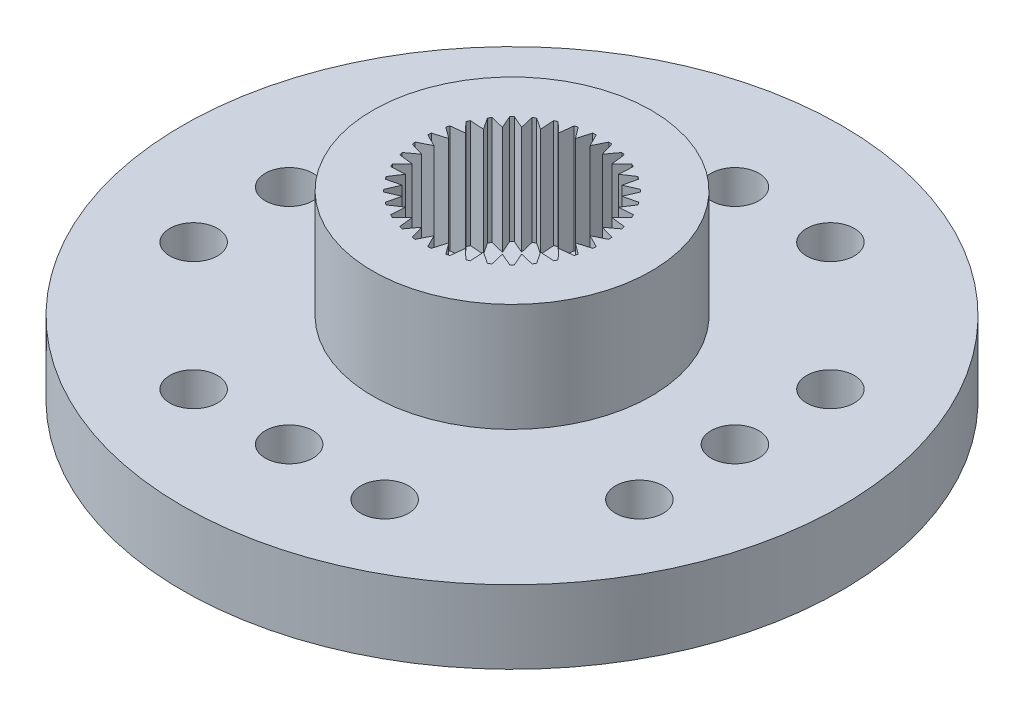
from build123d import *

# Parameters (mm, degrees)
SKETCH1_R                  = 4.375
BOSS_EXTRUDE1_DEPTH        = 3.4
CUT_EXTRUDE1_START         = -2.35
CUT_EXTRUDE1_OUTLINE_R     = 10.35
CUT_EXTRUDE1_OUTLINE_R_2   = 0.75
CUT_EXTRUDE1_OUTLINE_R_3   = 1.5
CUT_EXTRUDE1_DEPTH         = 2.05
CUT_EXTRUDE1_START_2       = -0.3
CUT_EXTRUDE1_2_OUTLINE_R   = 10.35
CUT_EXTRUDE1_2_OUTLINE_R_2 = 0.75
CUT_EXTRUDE1_2_OUTLINE_R_3 = 4.4
CUT_EXTRUDE1_2_OUTLINE_R_4 = 3.25
CUT_EXTRUDE1_2_OUTLINE_R_5 = 2.75
CUT_EXTRUDE1_2_DEPTH       = 0.25


# Read off the part's stored shape, not the designer's step: Cut-Extrude1
with BuildPart() as part:
    # Sketch1 → Boss-Extrude1 (new body)
    with BuildSketch(Plane(origin=(0, 5.75, 0), x_dir=(1, 0, 0), z_dir=(0, 1, 0))):
        with Locations(Location((0, 0, 0), (0, 0, 90))):
            Circle(SKETCH1_R)
        with BuildLine():
            Line((0, -2.45), (-0.196605286, -2.843210573))
            ThreePointArc((-0.196605286, -2.843210573), (-0.248393867, -2.83915489), (-0.300099924, -2.834155965))
            Line((-0.300099924, -2.834155965), (-0.425438035, -2.412778995))
            Line((-0.425438035, -2.412778995), (-0.687336745, -2.765875666))
            ThreePointArc((-0.687336745, -2.765875666), (-0.737634279, -2.752888605), (-0.787686751, -2.738986963))
            Line((-0.787686751, -2.738986963), (-0.837949351, -2.302246921))
            Line((-0.837949351, -2.302246921), (-1.157183824, -2.604501026))
            ThreePointArc((-1.157183824, -2.604501026), (-1.204462046, -2.582977193), (-1.251340114, -2.560595228))
            Line((-1.251340114, -2.560595228), (-1.225, -2.121762239))
            Line((-1.225, -2.121762239), (-1.591870459, -2.363989941))
            ThreePointArc((-1.591870459, -2.363989941), (-1.634692844, -2.334583326), (-1.676972141, -2.304401102))
            Line((-1.676972141, -2.304401102), (-1.574829644, -1.876808886))
            Line((-1.574829644, -1.876808886), (-1.978188915, -2.051650218))
            ThreePointArc((-1.978188915, -2.051650218), (-2.015254326, -2.015254326), (-2.051650218, -1.978188915))
            Line((-2.051650218, -1.978188915), (-1.876808886, -1.574829644))
            Line((-1.876808886, -1.574829644), (-2.304401102, -1.676972141))
            ThreePointArc((-2.304401102, -1.676972141), (-2.334583326, -1.634692844), (-2.363989941, -1.591870459))
            Line((-2.363989941, -1.591870459), (-2.121762239, -1.225))
            Line((-2.121762239, -1.225), (-2.560595228, -1.251340114))
            ThreePointArc((-2.560595228, -1.251340114), (-2.582977193, -1.204462046), (-2.604501026, -1.157183824))
            Line((-2.604501026, -1.157183824), (-2.302246921, -0.837949351))
            Line((-2.302246921, -0.837949351), (-2.738986963, -0.787686751))
            ThreePointArc((-2.738986963, -0.787686751), (-2.752888605, -0.737634279), (-2.765875666, -0.687336745))
            Line((-2.765875666, -0.687336745), (-2.412778995, -0.425438035))
            Line((-2.412778995, -0.425438035), (-2.834155965, -0.300099924))
            ThreePointArc((-2.834155965, -0.300099924), (-2.83915489, -0.248393867), (-2.843210573, -0.196605286))
            Line((-2.843210573, -0.196605286), (-2.45, 0))
            Line((-2.45, 0), (-2.843210573, 0.196605286))
            ThreePointArc((-2.843210573, 0.196605286), (-2.83915489, 0.248393867), (-2.834155965, 0.300099924))
            Line((-2.834155965, 0.300099924), (-2.412778995, 0.425438035))
            Line((-2.412778995, 0.425438035), (-2.765875666, 0.687336745))
            ThreePointArc((-2.765875666, 0.687336745), (-2.752888605, 0.737634279), (-2.738986963, 0.787686751))
            Line((-2.738986963, 0.787686751), (-2.302246921, 0.837949351))
            Line((-2.302246921, 0.837949351), (-2.604501026, 1.157183824))
            ThreePointArc((-2.604501026, 1.157183824), (-2.582977193, 1.204462046), (-2.560595228, 1.251340114))
            Line((-2.560595228, 1.251340114), (-2.121762239, 1.225))
            Line((-2.121762239, 1.225), (-2.363989941, 1.591870459))
            ThreePointArc((-2.363989941, 1.591870459), (-2.334583326, 1.634692844), (-2.304401102, 1.676972141))
            Line((-2.304401102, 1.676972141), (-1.876808886, 1.574829644))
            Line((-1.876808886, 1.574829644), (-2.051650218, 1.978188915))
            ThreePointArc((-2.051650218, 1.978188915), (-2.015254326, 2.015254326), (-1.978188915, 2.051650218))
            Line((-1.978188915, 2.051650218), (-1.574829644, 1.876808886))
            Line((-1.574829644, 1.876808886), (-1.676972141, 2.304401102))
            ThreePointArc((-1.676972141, 2.304401102), (-1.634692844, 2.334583326), (-1.591870459, 2.363989941))
            Line((-1.591870459, 2.363989941), (-1.225, 2.121762239))
            Line((-1.225, 2.121762239), (-1.251340114, 2.560595228))
            ThreePointArc((-1.251340114, 2.560595228), (-1.204462046, 2.582977193), (-1.157183824, 2.604501026))
            Line((-1.157183824, 2.604501026), (-0.837949351, 2.302246921))
            Line((-0.837949351, 2.302246921), (-0.787686751, 2.738986963))
            ThreePointArc((-0.787686751, 2.738986963), (-0.737634279, 2.752888605), (-0.687336745, 2.765875666))
            Line((-0.687336745, 2.765875666), (-0.425438035, 2.412778995))
            Line((-0.425438035, 2.412778995), (-0.300099924, 2.834155965))
            ThreePointArc((-0.300099924, 2.834155965), (-0.248393867, 2.83915489), (-0.196605286, 2.843210573))
            Line((-0.196605286, 2.843210573), (0, 2.45))
            Line((0, 2.45), (0.196605286, 2.843210573))
            ThreePointArc((0.196605286, 2.843210573), (0.248393867, 2.83915489), (0.300099924, 2.834155965))
            Line((0.300099924, 2.834155965), (0.425438035, 2.412778995))
            Line((0.425438035, 2.412778995), (0.687336745, 2.765875666))
            ThreePointArc((0.687336745, 2.765875666), (0.737634279, 2.752888605), (0.787686751, 2.738986963))
            Line((0.787686751, 2.738986963), (0.837949351, 2.302246921))
            Line((0.837949351, 2.302246921), (1.157183824, 2.604501026))
            ThreePointArc((1.157183824, 2.604501026), (1.204462046, 2.582977193), (1.251340114, 2.560595228))
            Line((1.251340114, 2.560595228), (1.225, 2.121762239))
            Line((1.225, 2.121762239), (1.591870459, 2.363989941))
            ThreePointArc((1.591870459, 2.363989941), (1.634692844, 2.334583326), (1.676972141, 2.304401102))
            Line((1.676972141, 2.304401102), (1.574829644, 1.876808886))
            Line((1.574829644, 1.876808886), (1.978188915, 2.051650218))
            ThreePointArc((1.978188915, 2.051650218), (2.015254326, 2.015254326), (2.051650218, 1.978188915))
            Line((2.051650218, 1.978188915), (1.876808886, 1.574829644))
            Line((1.876808886, 1.574829644), (2.304401102, 1.676972141))
            ThreePointArc((2.304401102, 1.676972141), (2.334583326, 1.634692844), (2.363989941, 1.591870459))
            Line((2.363989941, 1.591870459), (2.121762239, 1.225))
            Line((2.121762239, 1.225), (2.560595228, 1.251340114))
            ThreePointArc((2.560595228, 1.251340114), (2.582977193, 1.204462046), (2.604501026, 1.157183824))
            Line((2.604501026, 1.157183824), (2.302246921, 0.837949351))
            Line((2.302246921, 0.837949351), (2.738986963, 0.787686751))
            ThreePointArc((2.738986963, 0.787686751), (2.752888605, 0.737634279), (2.765875666, 0.687336745))
            Line((2.765875666, 0.687336745), (2.412778995, 0.425438035))
            Line((2.412778995, 0.425438035), (2.834155965, 0.300099924))
            ThreePointArc((2.834155965, 0.300099924), (2.83915489, 0.248393867), (2.843210573, 0.196605286))
            Line((2.843210573, 0.196605286), (2.45, 0))
            Line((2.45, 0), (2.843210573, -0.196605286))
            ThreePointArc((2.843210573, -0.196605286), (2.83915489, -0.248393867), (2.834155965, -0.300099924))
            Line((2.834155965, -0.300099924), (2.412778995, -0.425438035))
            Line((2.412778995, -0.425438035), (2.765875666, -0.687336745))
            ThreePointArc((2.765875666, -0.687336745), (2.752888605, -0.737634279), (2.738986963, -0.787686751))
            Line((2.738986963, -0.787686751), (2.302246921, -0.837949351))
            Line((2.302246921, -0.837949351), (2.604501026, -1.157183824))
            ThreePointArc((2.604501026, -1.157183824), (2.582977193, -1.204462046), (2.560595228, -1.251340114))
            Line((2.560595228, -1.251340114), (2.121762239, -1.225))
            Line((2.121762239, -1.225), (2.363989941, -1.591870459))
            ThreePointArc((2.363989941, -1.591870459), (2.334583326, -1.634692844), (2.304401102, -1.676972141))
            Line((2.304401102, -1.676972141), (1.876808886, -1.574829644))
            Line((1.876808886, -1.574829644), (2.051650218, -1.978188915))
            ThreePointArc((2.051650218, -1.978188915), (2.015254326, -2.015254326), (1.978188915, -2.051650218))
            Line((1.978188915, -2.051650218), (1.574829644, -1.876808886))
            Line((1.574829644, -1.876808886), (1.676972141, -2.304401102))
            ThreePointArc((1.676972141, -2.304401102), (1.634692844, -2.334583326), (1.591870459, -2.363989941))
            Line((1.591870459, -2.363989941), (1.225, -2.121762239))
            Line((1.225, -2.121762239), (1.251340114, -2.560595228))
            ThreePointArc((1.251340114, -2.560595228), (1.204462046, -2.582977193), (1.157183824, -2.604501026))
            Line((1.157183824, -2.604501026), (0.837949351, -2.302246921))
            Line((0.837949351, -2.302246921), (0.787686751, -2.738986963))
            ThreePointArc((0.787686751, -2.738986963), (0.737634279, -2.752888605), (0.687336745, -2.765875666))
            Line((0.687336745, -2.765875666), (0.425438035, -2.412778995))
            Line((0.425438035, -2.412778995), (0.300099924, -2.834155965))
            ThreePointArc((0.300099924, -2.834155965), (0.248393867, -2.83915489), (0.196605286, -2.843210573))
            Line((0.196605286, -2.843210573), (0, -2.45))
        make_face(mode=Mode.SUBTRACT)
    extrude(amount=-BOSS_EXTRUDE1_DEPTH)


with BuildPart() as body_2:
    # Cut-Extrude1 outline → Cut-Extrude1 (new body)
    with BuildSketch(Plane.XZ.offset(CUT_EXTRUDE1_START)):
        Circle(CUT_EXTRUDE1_OUTLINE_R)
        with Locations((-3, -7)):
            Circle(CUT_EXTRUDE1_OUTLINE_R_2, mode=Mode.SUBTRACT)
        with Locations((-7, -3)):
            Circle(CUT_EXTRUDE1_OUTLINE_R_2, mode=Mode.SUBTRACT)
        with Locations((0, -7)):
            Circle(CUT_EXTRUDE1_OUTLINE_R_2, mode=Mode.SUBTRACT)
        with Locations((3, -7)):
            Circle(CUT_EXTRUDE1_OUTLINE_R_2, mode=Mode.SUBTRACT)
        with Locations((7, -3)):
            Circle(CUT_EXTRUDE1_OUTLINE_R_2, mode=Mode.SUBTRACT)
        with Locations((-7, 0)):
            Circle(CUT_EXTRUDE1_OUTLINE_R_2, mode=Mode.SUBTRACT)
        with Locations((-7, 3)):
            Circle(CUT_EXTRUDE1_OUTLINE_R_2, mode=Mode.SUBTRACT)
        with Locations((-3, 7)):
            Circle(CUT_EXTRUDE1_OUTLINE_R_2, mode=Mode.SUBTRACT)
        with Locations((7, 0)):
            Circle(CUT_EXTRUDE1_OUTLINE_R_2, mode=Mode.SUBTRACT)
        with Locations((7, 3)):
            Circle(CUT_EXTRUDE1_OUTLINE_R_2, mode=Mode.SUBTRACT)
        with Locations((0, 7)):
            Circle(CUT_EXTRUDE1_OUTLINE_R_2, mode=Mode.SUBTRACT)
        with Locations((3, 7)):
            Circle(CUT_EXTRUDE1_OUTLINE_R_2, mode=Mode.SUBTRACT)
        Circle(CUT_EXTRUDE1_OUTLINE_R_3, mode=Mode.SUBTRACT)
    extrude(amount=CUT_EXTRUDE1_DEPTH)

    # Cut-Extrude1 2 outline → Cut-Extrude1 2 (add)
    # profile 1 of 2: a face of its own
    with BuildSketch(Plane.XZ.offset(CUT_EXTRUDE1_START_2)):
        Circle(CUT_EXTRUDE1_2_OUTLINE_R)
        with Locations((-3, -7)):
            Circle(CUT_EXTRUDE1_2_OUTLINE_R_2, mode=Mode.SUBTRACT)
        with Locations((-7, -3)):
            Circle(CUT_EXTRUDE1_2_OUTLINE_R_2, mode=Mode.SUBTRACT)
        with Locations((0, -7)):
            Circle(CUT_EXTRUDE1_2_OUTLINE_R_2, mode=Mode.SUBTRACT)
        with Locations((3, -7)):
            Circle(CUT_EXTRUDE1_2_OUTLINE_R_2, mode=Mode.SUBTRACT)
        with Locations((7, -3)):
            Circle(CUT_EXTRUDE1_2_OUTLINE_R_2, mode=Mode.SUBTRACT)
        with Locations((-7, 0)):
            Circle(CUT_EXTRUDE1_2_OUTLINE_R_2, mode=Mode.SUBTRACT)
        with Locations((-7, 3)):
            Circle(CUT_EXTRUDE1_2_OUTLINE_R_2, mode=Mode.SUBTRACT)
        with Locations((-3, 7)):
            Circle(CUT_EXTRUDE1_2_OUTLINE_R_2, mode=Mode.SUBTRACT)
        Circle(CUT_EXTRUDE1_2_OUTLINE_R_3, mode=Mode.SUBTRACT)
        with Locations((7, 0)):
            Circle(CUT_EXTRUDE1_2_OUTLINE_R_2, mode=Mode.SUBTRACT)
        with Locations((7, 3)):
            Circle(CUT_EXTRUDE1_2_OUTLINE_R_2, mode=Mode.SUBTRACT)
        with Locations((0, 7)):
            Circle(CUT_EXTRUDE1_2_OUTLINE_R_2, mode=Mode.SUBTRACT)
        with Locations((3, 7)):
            Circle(CUT_EXTRUDE1_2_OUTLINE_R_2, mode=Mode.SUBTRACT)
    # profile 2 of 2: a face of its own
    with BuildSketch(Plane.XZ.offset(CUT_EXTRUDE1_START_2)):
        Circle(CUT_EXTRUDE1_2_OUTLINE_R_4)
        Circle(CUT_EXTRUDE1_2_OUTLINE_R_5, mode=Mode.SUBTRACT)
    extrude(amount=CUT_EXTRUDE1_2_DEPTH)


solid = Compound([part.part, body_2.part])
